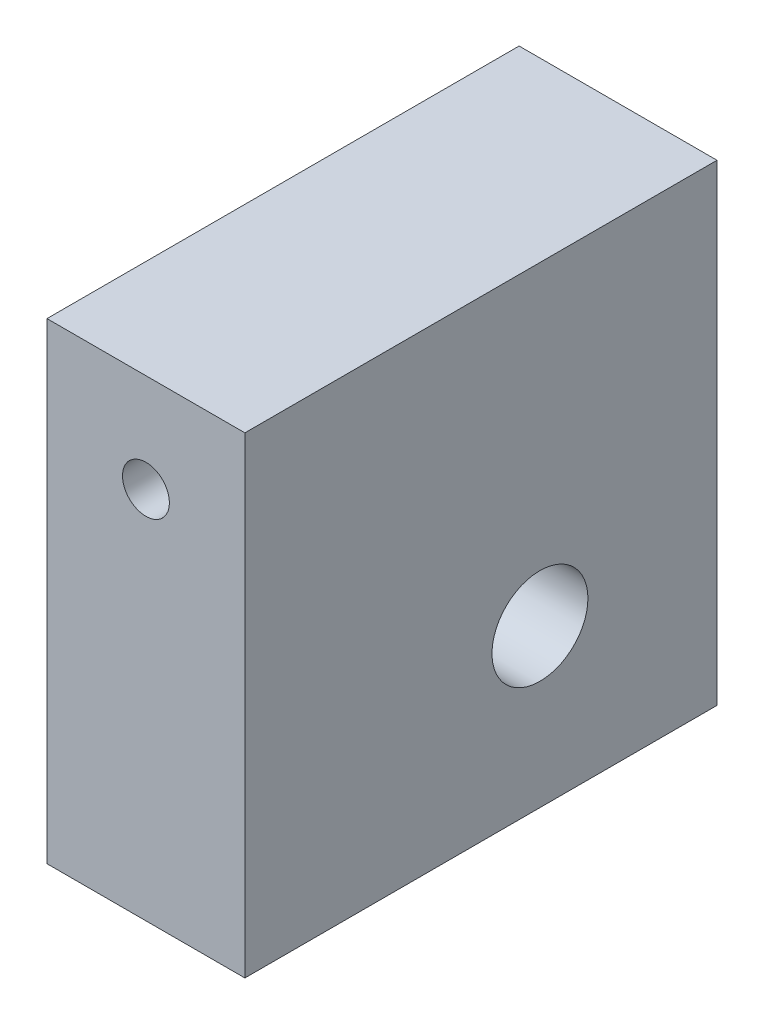
from build123d import *

# Parameters (mm, degrees)
SKETCH1_W                     = 12
SKETCH1_H                     = 12
BOSS_EXTRUDE1_DEPTH           = 5.03
TAP_DRILL_FOR_0_80_TAP1_D     = 1.19126
TAP_DRILL_FOR_0_80_TAP1_DEPTH = 4
TAP_DRILL_FOR_0_80_TAP1_TIP   = 0.357890611
F_2_CLEARANCE_HOLE1_D         = 2.4384


with BuildPart() as part:
    # Sketch1 → Boss-Extrude1 (new body)
    with BuildSketch(Plane(origin=(0, 0, 0), x_dir=(0, 0, -1), z_dir=(1, 0, 0))):
        with Locations((6, 6)):
            Rectangle(SKETCH1_W, SKETCH1_H)
    extrude(amount=BOSS_EXTRUDE1_DEPTH)

    # Tap Drill for #0-80 Tap1
    with Locations(Plane.XY):
        with Locations((2.515, 9.5)):
            Hole(TAP_DRILL_FOR_0_80_TAP1_D / 2, depth=TAP_DRILL_FOR_0_80_TAP1_DEPTH)
            with Locations((0, 0, -(TAP_DRILL_FOR_0_80_TAP1_DEPTH + TAP_DRILL_FOR_0_80_TAP1_TIP / 2))):  # 118° drill point
                Cone(0, TAP_DRILL_FOR_0_80_TAP1_D / 2, TAP_DRILL_FOR_0_80_TAP1_TIP, mode=Mode.SUBTRACT)

    # #2 Clearance Hole1 (through all)
    with Locations(Plane(origin=(5.03, 0, 0), x_dir=(0, 0, -1), z_dir=(1, 0, 0))):
        with Locations((7.5, 4)):
            Hole(F_2_CLEARANCE_HOLE1_D / 2)


solid = part.part
